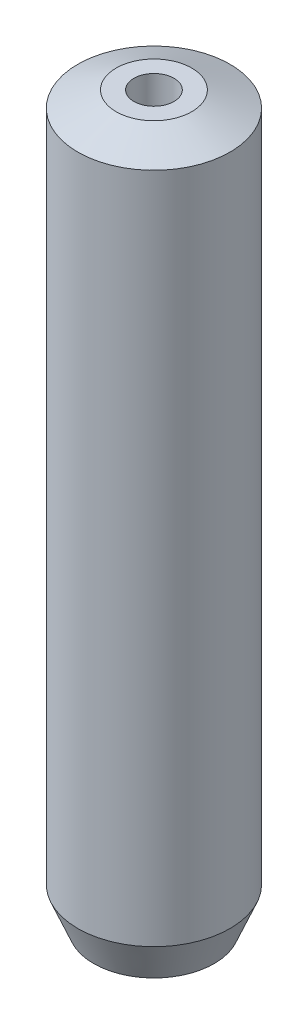
from build123d import *
from OCP.BRepFilletAPI import BRepFilletAPI_MakeChamfer

# Parameters (mm, degrees)
SKETCH1_R           = 5
BOSS_EXTRUDE1_DEPTH = 47.713895819
SKETCH2_R           = 1.319395935
CUT_EXTRUDE1_DEPTH  = 49.235006523
CHAMFER1_SIZE       = 1.039574007
CHAMFER1_SIZE2      = 2.515900915


with BuildPart() as part:
    # Sketch1 → Boss-Extrude1 (new body)
    with BuildSketch(Plane(origin=(0, 0, 0), x_dir=(1, 0, 0), z_dir=(0, 1, 0))):
        Circle(SKETCH1_R)
    extrude(amount=BOSS_EXTRUDE1_DEPTH)

    # Sketch2 → Cut-Extrude1 (cut, through all)
    with BuildSketch(Plane(origin=(0, 0, 0), x_dir=(1, 0, 0), z_dir=(0, 1, 0))):
        Circle(SKETCH2_R)
    extrude(amount=CUT_EXTRUDE1_DEPTH, mode=Mode.SUBTRACT)

    # Chamfer1: one chamfer whose edges measure the first distance from different faces: ONE call of the kernel's chamfer builder (chamfer() names one face for all edges)
    chamfer1_edges_1 = [part.edges().sort_by_distance(p)[0] for p in [
        (-5, 47.713895819, 0),
    ]]
    chamfer1_side_1 = [part.faces().sort_by_distance(p)[0] for p in [
        (-5, 23.85694791, 0),
    ]]
    chamfer1_edges_2 = [part.edges().sort_by_distance(p)[0] for p in [
        (-5, 0, 0),
    ]]
    chamfer1_side_2 = [part.faces().sort_by_distance(p)[0] for p in [
        (-4.858578644, 0, 0),
    ]]
    chamfer1 = BRepFilletAPI_MakeChamfer(part.part.solid().wrapped)
    for e in chamfer1_edges_1:
        chamfer1.Add(CHAMFER1_SIZE, CHAMFER1_SIZE2, e.wrapped, chamfer1_side_1[0].wrapped)  # the first distance lies on this face
    for e in chamfer1_edges_2:
        chamfer1.Add(CHAMFER1_SIZE, CHAMFER1_SIZE2, e.wrapped, chamfer1_side_2[0].wrapped)  # the first distance lies on this face
    add(Compound.cast(chamfer1.Shape()), mode=Mode.REPLACE)


solid = part.part
